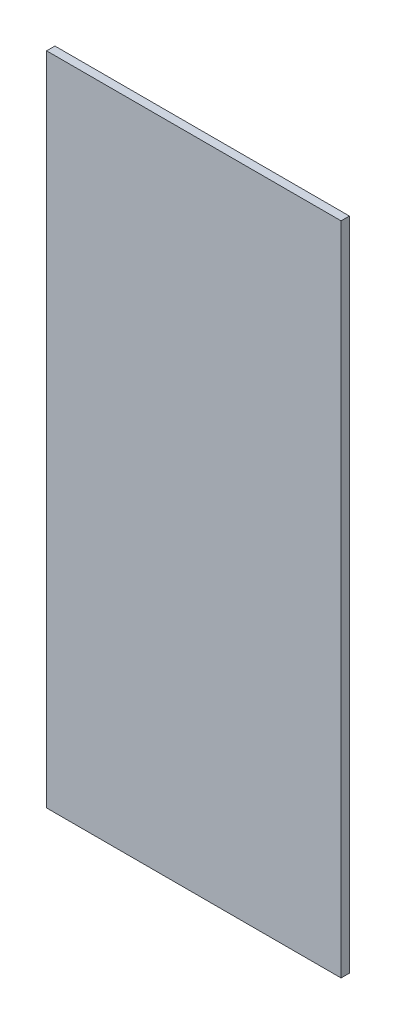
from build123d import *

# Parameters (mm, degrees)
SKETCH1_W           = 224.546707254
SKETCH1_H           = 500
BOSS_EXTRUDE1_DEPTH = 6.35


with BuildPart() as part:
    # Sketch1 → Boss-Extrude1 (new body)
    with BuildSketch(Plane.XY):
        with Locations((21.739808764, 53.602194644)):
            Rectangle(SKETCH1_W, SKETCH1_H)
    extrude(amount=BOSS_EXTRUDE1_DEPTH)


solid = part.part
